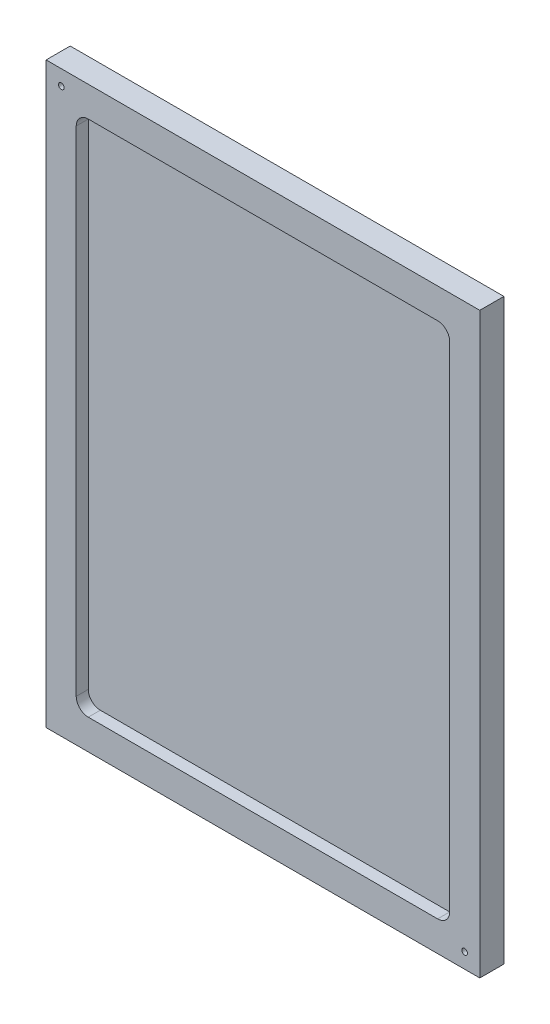
from build123d import *

# Parameters (mm, degrees)
SKETCH1_W                    = 228.6
SKETCH1_H                    = 304.8
BOSS_EXTRUDE1_DEPTH          = 12.7
CUT_EXTRUDE1_DEPTH           = 6.35
F_3_0_3_DIAMETER_HOLE1_D     = 3
F_3_0_3_DIAMETER_HOLE1_DEPTH = 5
F_3_0_3_DIAMETER_HOLE1_TIP   = 0.901290929


with BuildPart() as part:
    # Sketch1 → Boss-Extrude1 (new body)
    with BuildSketch(Plane.XY):
        Rectangle(SKETCH1_W, SKETCH1_H)
    extrude(amount=BOSS_EXTRUDE1_DEPTH)

    # Sketch2 → Cut-Extrude1 (cut)
    with BuildSketch(Plane.XY.offset(12.7)):
        with BuildLine():
            Line((92.075, -136.525), (-92.075, -136.525))
            ThreePointArc((-92.075, -136.525), (-96.565128061, -134.665128061), (-98.425, -130.175))
            Line((-98.425, -130.175), (-98.425, 130.175))
            ThreePointArc((-98.425, 130.175), (-96.565128061, 134.665128061), (-92.075, 136.525))
            Line((-92.075, 136.525), (92.075, 136.525))
            ThreePointArc((92.075, 136.525), (96.565128061, 134.665128061), (98.425, 130.175))
            Line((98.425, 130.175), (98.425, -130.175))
            ThreePointArc((98.425, -130.175), (96.565128061, -134.665128061), (92.075, -136.525))
        make_face()
    extrude(amount=-CUT_EXTRUDE1_DEPTH, mode=Mode.SUBTRACT)

    # Ø3.0 (3) Diameter Hole1
    with Locations(Plane.XY.offset(12.7)):
        with Locations((-106.3, 144.4), (106.3, -144.4)):
            Hole(F_3_0_3_DIAMETER_HOLE1_D / 2, depth=F_3_0_3_DIAMETER_HOLE1_DEPTH)
            with Locations((0, 0, -(F_3_0_3_DIAMETER_HOLE1_DEPTH + F_3_0_3_DIAMETER_HOLE1_TIP / 2))):  # 118° drill point
                Cone(0, F_3_0_3_DIAMETER_HOLE1_D / 2, F_3_0_3_DIAMETER_HOLE1_TIP, mode=Mode.SUBTRACT)


solid = part.part
